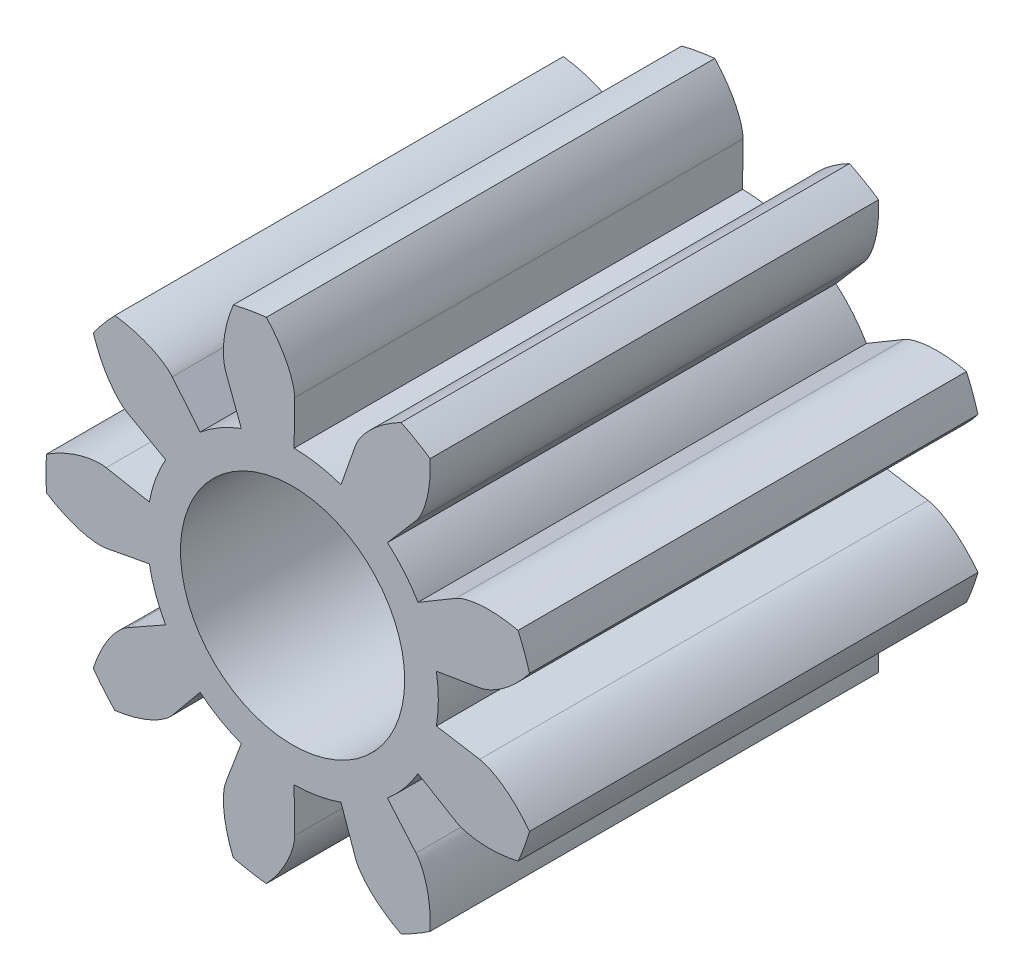
from build123d import *

# Parameters (mm, degrees)
SKETCH_1_R               = 2.2
SKETCH_1_R_2             = 1
EXTRUDE_1_DEPTH          = 4
CUT_EXTRUDE_1_DEPTH      = 6.067543784
PATTERN_CIRCULAR_1_COUNT = 9
PATTERN_CIRCULAR_1_ANGLE = 320


with BuildPart() as part:
    # 草图1 → 凸台-拉伸1 (new body)
    with BuildSketch(Plane.XY):
        Circle(SKETCH_1_R)
        Circle(SKETCH_1_R_2, mode=Mode.SUBTRACT)
    extrude(amount=EXTRUDE_1_DEPTH)

    # 草图1<3> → 切除-拉伸1 (cut, through all)
    with BuildSketch(Plane.XY):
        with BuildLine():
            Line((1.668777663, 0.275994764), (1.28257718, 0.212122078))
            ThreePointArc((1.28257718, 0.212122078), (1.295636974, 0.106418197), (1.3, 0))
            ThreePointArc((1.3, 0), (1.295636974, -0.106418197), (1.28257718, -0.212122078))
            Line((1.28257718, -0.212122078), (1.668777663, -0.275994764))
            add(Edge.make_bspline(
                [(1.668777663, -0.275994764), (1.681496761, -0.278098342), (1.716538761, -0.28672295), (1.780373215, -0.313392423), (1.876895792, -0.370481257), (1.976755221, -0.452857378), (2.049489285, -0.529748795), (2.095568426, -0.586317158), (2.113743491, -0.609990535)],
                knots=[0, 0, 0, 0, 0, 0.005604068, 0.015718248, 0.029959916, 0.048733667, 0.061737159, 0.061737159, 0.061737159, 0.061737159, 0.061737159], degree=4))
            ThreePointArc((2.113743491, -0.609990535), (2.17832914, -0.308029478), (2.2, 0))
            ThreePointArc((2.2, 0), (2.17832914, 0.308029478), (2.113743491, 0.609990535))
            add(Edge.make_bspline(
                [(1.668777663, 0.275994764), (1.681496761, 0.278098342), (1.716538761, 0.28672295), (1.780373215, 0.313392423), (1.876895792, 0.370481257), (1.976755221, 0.452857378), (2.049489285, 0.529748795), (2.095568426, 0.586317158), (2.113743491, 0.609990535)],
                knots=[0, 0, 0, 0, 0, 0.005604068, 0.015718248, 0.029959916, 0.048733667, 0.061737159, 0.061737159, 0.061737159, 0.061737159, 0.061737159], degree=4))
        make_face()
    cut_extrude_1 = extrude(amount=CUT_EXTRUDE_1_DEPTH, mode=Mode.SUBTRACT)

    # 阵列(圆周)1: 切除-拉伸1 ×9 about axis
    pattern_circular_1_axis = Axis((0, 0, 4), (0, 0, 1))
    for i in range(1, PATTERN_CIRCULAR_1_COUNT):
        add(cut_extrude_1.rotate(pattern_circular_1_axis, i * PATTERN_CIRCULAR_1_ANGLE / (PATTERN_CIRCULAR_1_COUNT - 1)), mode=Mode.SUBTRACT)


solid = part.part
